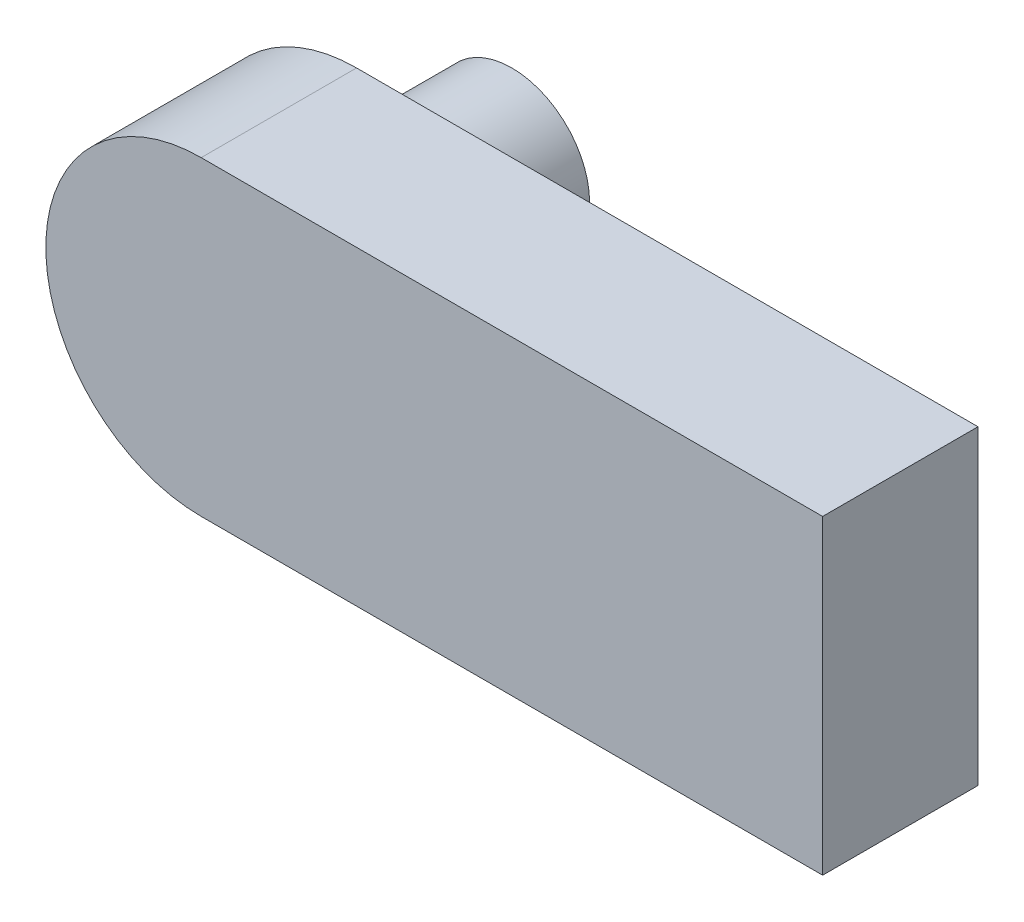
from build123d import *

# Parameters (mm, degrees)
ESTRUSIONE_ESTRUSIONE1_DEPTH = 5
SCHIZZO2_R                   = 2.5
ESTRUSIONE_ESTRUSIONE2_DEPTH = 5


with BuildPart() as part:
    # Schizzo1 → Estrusione-Estrusione1 (new body)
    with BuildSketch(Plane.XY):
        with BuildLine():
            Line((0, 4.503546099), (-20, 4.503546099))
            ThreePointArc((-20, 4.503546099), (-25, -0.496453901), (-20, -5.496453901))
            Line((-20, -5.496453901), (0, -5.496453901))
            Line((0, -5.496453901), (0, 4.503546099))
        make_face()
    extrude(amount=ESTRUSIONE_ESTRUSIONE1_DEPTH)

    # Schizzo2 → Estrusione-Estrusione2 (add)
    with BuildSketch(Plane(origin=(0, 0, 0), x_dir=(-1, 0, 0), z_dir=(0, 0, -1))):
        with Locations((20, -0.496453901)):
            Circle(SCHIZZO2_R)
    extrude(amount=ESTRUSIONE_ESTRUSIONE2_DEPTH)


solid = part.part
